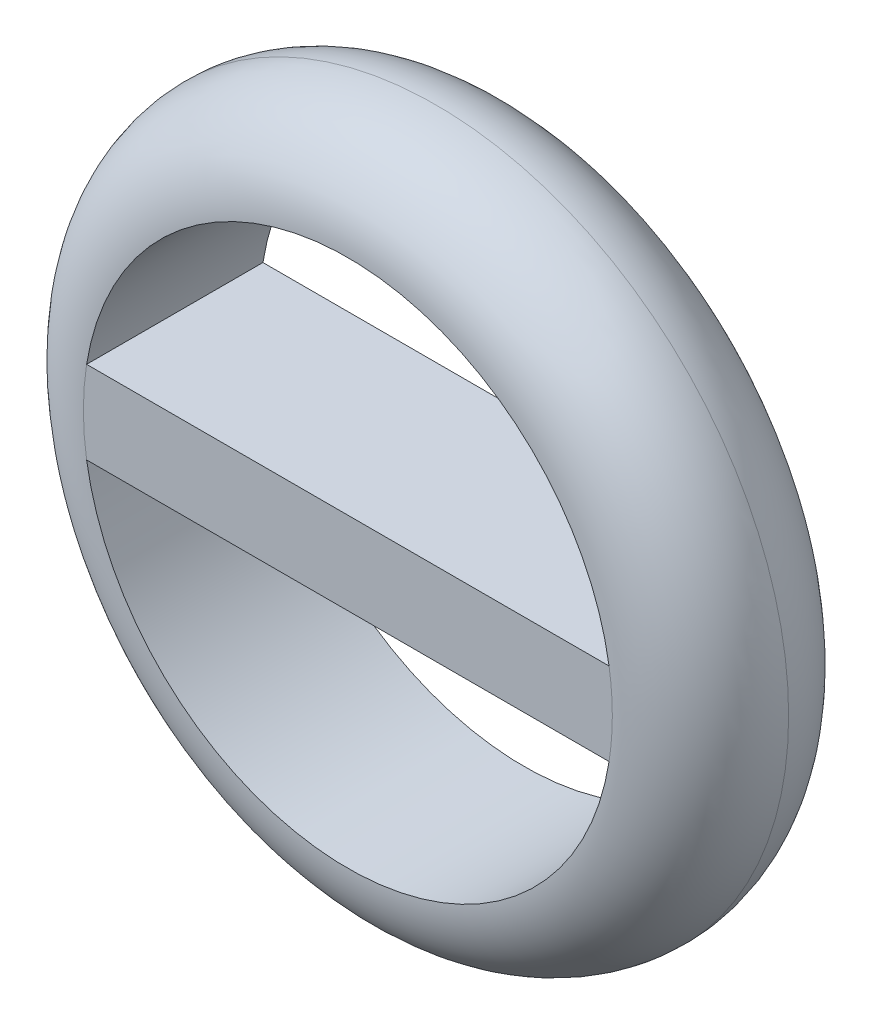
from build123d import *

# Parameters (mm, degrees)
SKETCH1_R           = 20
BOSS_EXTRUDE1_DEPTH = 10
FILLET1_R           = 5


with BuildPart() as part:
    # Sketch1 → Boss-Extrude1 (new body)
    with BuildSketch(Plane.XY):
        Circle(SKETCH1_R)
        with BuildLine():
            Line((14.81529648, 2.346697725), (-14.81529648, 2.346697725))
            ThreePointArc((-14.81529648, 2.346697725), (0, 15), (14.81529648, 2.346697725))
        make_face(mode=Mode.SUBTRACT)
        with BuildLine():
            Line((14.81529648, -2.346697725), (-14.81529648, -2.346697725))
            ThreePointArc((-14.81529648, -2.346697725), (0, -15), (14.81529648, -2.346697725))
        make_face(mode=Mode.SUBTRACT)
    extrude(amount=BOSS_EXTRUDE1_DEPTH)

    # Fillet1
    fillet1_edges = [part.edges().sort_by_distance(p)[0] for p in [
        (-20, 0, 10),
        (-20, 0, 0),
    ]]
    fillet(fillet1_edges, radius=FILLET1_R - 0.0001)  # a hair under: the kernel refuses the full size


solid = part.part
